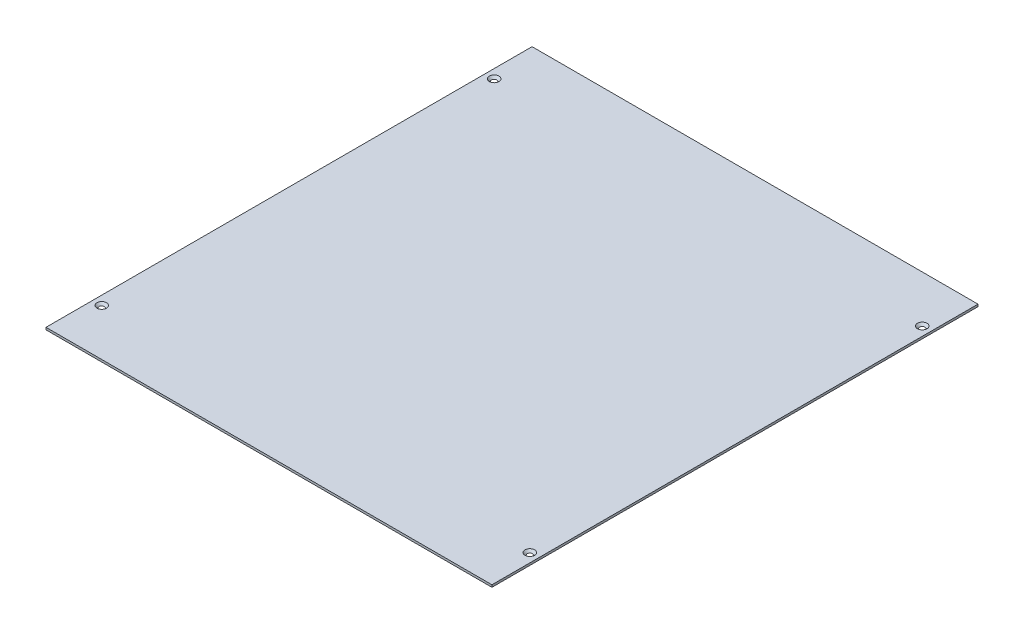
from build123d import *

# Parameters (mm, degrees)
SKETCH_1_W      = 400
SKETCH_1_H      = 436
SKETCH_1_R      = 2.25
EXTRUDE_1_DEPTH = 2
CHAMFER_1_SIZE  = 2.05


with BuildPart() as part:
    # Эскиз1 → Бобышка-Вытянуть1 (new body)
    with BuildSketch(Plane(origin=(0, 0, 0), x_dir=(1, 0, 0), z_dir=(0, 1, 0))):
        with Locations((200, 218)):
            Rectangle(SKETCH_1_W, SKETCH_1_H)
        with Locations(Location((8, 394, 0), (0, 0, 270))):
            Circle(SKETCH_1_R, mode=Mode.SUBTRACT)
        with Locations(Location((392, 394, 0), (0, 0, 270))):
            Circle(SKETCH_1_R, mode=Mode.SUBTRACT)
        with Locations(Location((392, 42, 0), (0, 0, 270))):
            Circle(SKETCH_1_R, mode=Mode.SUBTRACT)
        with Locations(Location((8, 42, 0), (0, 0, 270))):
            Circle(SKETCH_1_R, mode=Mode.SUBTRACT)
    extrude(amount=EXTRUDE_1_DEPTH)

    # Фаска1
    # the kernel refuses this chamfer: 2.05 mm, written as the material it takes off along each edge
    with BuildSketch(Plane(origin=(392, 2, -394), x_dir=(0, 0, 1), z_dir=(-1, 0, 0))) as chamfer_1_piece_1:
        Polygon((2.25, -CHAMFER_1_SIZE), (2.25 + CHAMFER_1_SIZE, 0), (2.25, 0), align=None)
    revolve(axis=Axis((392, 2, -394), (0, 1, 0)), mode=Mode.SUBTRACT)
    with BuildSketch(Plane(origin=(392, 2, -42), x_dir=(0, 0, 1), z_dir=(-1, 0, 0))) as chamfer_1_piece_2:
        Polygon((2.25, -CHAMFER_1_SIZE), (2.25 + CHAMFER_1_SIZE, 0), (2.25, 0), align=None)
    revolve(axis=Axis((392, 2, -42), (0, 1, 0)), mode=Mode.SUBTRACT)
    with BuildSketch(Plane(origin=(8, 2, -394), x_dir=(0, 0, 1), z_dir=(-1, 0, 0))) as chamfer_1_piece_3:
        Polygon((2.25, -CHAMFER_1_SIZE), (2.25 + CHAMFER_1_SIZE, 0), (2.25, 0), align=None)
    revolve(axis=Axis((8, 2, -394), (0, 1, 0)), mode=Mode.SUBTRACT)
    with BuildSketch(Plane(origin=(8, 2, -42), x_dir=(0, 0, 1), z_dir=(-1, 0, 0))) as chamfer_1_piece_4:
        Polygon((2.25, -CHAMFER_1_SIZE), (2.25 + CHAMFER_1_SIZE, 0), (2.25, 0), align=None)
    revolve(axis=Axis((8, 2, -42), (0, 1, 0)), mode=Mode.SUBTRACT)


solid = part.part
